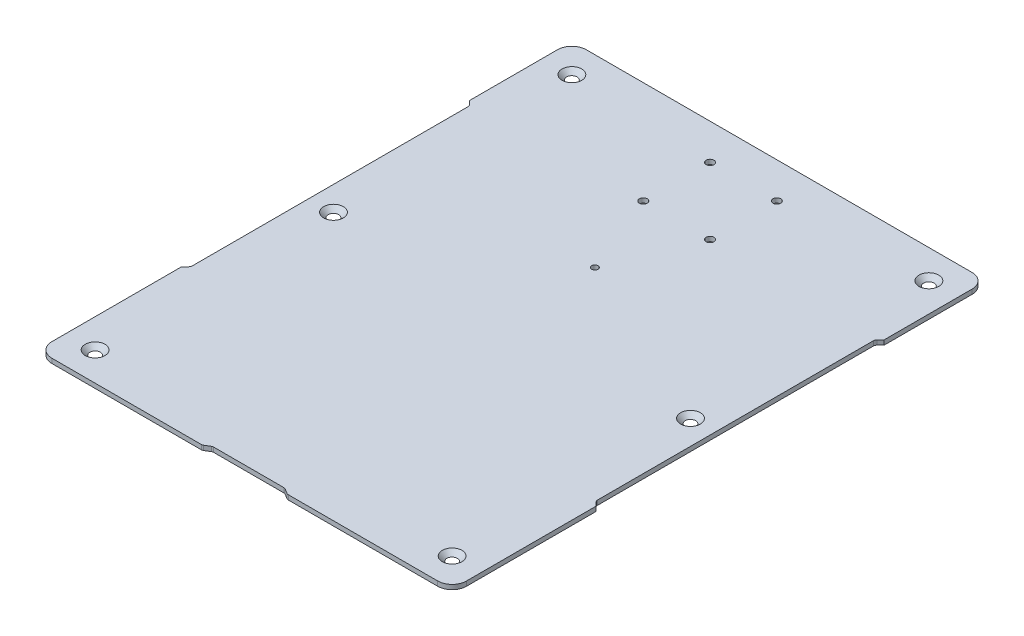
from build123d import *

# Parameters (mm, degrees)
SKETCH1_W           = 360
SKETCH1_H           = 464
SKETCH1_R           = 3.4
SKETCH1_R_2         = 2.731026391
BOSS_EXTRUDE1_DEPTH = 4
FILLET1_R           = 12.5
SKETCH5_R           = 3.4
CUT_EXTRUDE4_DEPTH  = 20
CUT_EXTRUDE5_DEPTH  = 10
CUT_EXTRUDE6_DEPTH  = 10
FILLET2_R           = 3
CHAMFER1_SIZE       = 5.15


with BuildPart() as part:
    # Sketch1 → Boss-Extrude1 (new body)
    with BuildSketch(Plane(origin=(0, 30, 0), x_dir=(1, 0, 0), z_dir=(0, 1, 0))):
        Rectangle(SKETCH1_W, SKETCH1_H)
        with Locations(Location((-155, 207, 0), (0, 0, 270))):
            Circle(SKETCH1_R, mode=Mode.SUBTRACT)
        with Locations(Location((155, 207, 0), (0, 0, 90))):
            Circle(SKETCH1_R, mode=Mode.SUBTRACT)
        with Locations(Location((-155, -207, 0), (0, 0, 270))):
            Circle(SKETCH1_R, mode=Mode.SUBTRACT)
        with Locations(Location((155, -207, 0), (0, 0, 90))):
            Circle(SKETCH1_R, mode=Mode.SUBTRACT)
        with Locations(Location((-155, 0, 0), (0, 0, 270))):
            Circle(SKETCH1_R, mode=Mode.SUBTRACT)
        with Locations(Location((155, 0, 0), (0, 0, 90))):
            Circle(SKETCH1_R, mode=Mode.SUBTRACT)
        with Locations(Location((0, 72, 0), (0, 0, 270))):
            Circle(SKETCH1_R_2, mode=Mode.SUBTRACT)
    extrude(amount=-BOSS_EXTRUDE1_DEPTH)

    # Fillet1
    fillet1_edges = [part.edges().sort_by_distance(p)[0] for p in [
        (180, 28, -232),
        (180, 28, 232),
        (-180, 28, 232),
        (-180, 28, -232),
    ]]
    fillet(fillet1_edges, radius=FILLET1_R)

    # Sketch5 → Cut-Extrude4 (cut)
    with BuildSketch(Plane(origin=(0, 40, 377.333920735), x_dir=(0, 0, 1), z_dir=(0, 1, 0))):
        with Locations((-520.342542706, 28.991378029)):
            Circle(SKETCH5_R)
        with Locations((-520.342542706, -28.991378029)):
            Circle(SKETCH5_R)
        with Locations((-578.325298763, -28.991378029)):
            Circle(SKETCH5_R)
        with Locations((-578.325298763, 28.991378029)):
            Circle(SKETCH5_R)
    extrude(amount=-CUT_EXTRUDE4_DEPTH, mode=Mode.SUBTRACT)

    # Sketch6 → Cut-Extrude5 (cut)
    with BuildSketch(Plane(origin=(0, 30, 0), x_dir=(1, 0, 0), z_dir=(0, 1, 0))):
        Polygon((-176, -102.929588377), (-176, 139.070411623), (-188.727922061, 151.798333685), (-188.727922061, -115.657510438), align=None)
    cut_extrude5 = extrude(amount=-CUT_EXTRUDE5_DEPTH, mode=Mode.SUBTRACT)

    # Sketch7 → Cut-Extrude6 (cut)
    with BuildSketch(Plane(origin=(0, 30, 0), x_dir=(1, 0, 0), z_dir=(0, 1, 0))):
        Polygon((-31.320564901, -228.594250629), (31.320564901, -228.594250629), (45, -236.893229805), (-45, -236.893229805), align=None)
    extrude(amount=-CUT_EXTRUDE6_DEPTH, mode=Mode.SUBTRACT)

    # Mirror2: Cut-Extrude5 across plane
    add(cut_extrude5.mirror(Plane(origin=(0, 0, 0), x_dir=(0, 0, 1), z_dir=(1, 0, 0))), mode=Mode.SUBTRACT)

    # Fillet2
    fillet2_edges = [part.edges().sort_by_distance(p)[0] for p in [
        (36.934355042, 28, 232),
        (-36.934355042, 28, 232),
        (-31.320564901, 28, 228.594250629),
        (31.320564901, 28, 228.594250629),
        (176, 28, 102.929588377),
        (176, 28, -139.070411623),
        (-176, 28, -139.070411623),
        (-176, 28, 102.929588377),
    ]]
    fillet(fillet2_edges, radius=FILLET2_R)

    # Chamfer1
    # the kernel refuses this chamfer: 5.15 mm, written as the material it takes off along each edge
    with BuildSketch(Plane(origin=(-155, 30, -207), x_dir=(0, 0, 1), z_dir=(-1, 0, 0))) as chamfer1_piece_1:
        Polygon((3.4 + CHAMFER1_SIZE, 0), (3.4, -CHAMFER1_SIZE), (3.4, 0), align=None)
    revolve(axis=Axis((-155, 30, -207), (0, 1, 0)), mode=Mode.SUBTRACT)
    with BuildSketch(Plane(origin=(155, 30, 207), x_dir=(0, 0, -1), z_dir=(1, 0, 0))) as chamfer1_piece_2:
        Polygon((3.4 + CHAMFER1_SIZE, 0), (3.4, -CHAMFER1_SIZE), (3.4, 0), align=None)
    revolve(axis=Axis((155, 30, 207), (0, 1, 0)), mode=Mode.SUBTRACT)
    with BuildSketch(Plane(origin=(155, 30, 0), x_dir=(0, 0, -1), z_dir=(1, 0, 0))) as chamfer1_piece_3:
        Polygon((3.4 + CHAMFER1_SIZE, 0), (3.4, -CHAMFER1_SIZE), (3.4, 0), align=None)
    revolve(axis=Axis((155, 30, 0), (0, 1, 0)), mode=Mode.SUBTRACT)
    with BuildSketch(Plane(origin=(-155, 30, 207), x_dir=(0, 0, 1), z_dir=(-1, 0, 0))) as chamfer1_piece_4:
        Polygon((3.4 + CHAMFER1_SIZE, 0), (3.4, -CHAMFER1_SIZE), (3.4, 0), align=None)
    revolve(axis=Axis((-155, 30, 207), (0, 1, 0)), mode=Mode.SUBTRACT)
    with BuildSketch(Plane(origin=(-155, 30, 0), x_dir=(0, 0, 1), z_dir=(-1, 0, 0))) as chamfer1_piece_5:
        Polygon((3.4 + CHAMFER1_SIZE, 0), (3.4, -CHAMFER1_SIZE), (3.4, 0), align=None)
    revolve(axis=Axis((-155, 30, 0), (0, 1, 0)), mode=Mode.SUBTRACT)
    with BuildSketch(Plane(origin=(155, 30, -207), x_dir=(0, 0, -1), z_dir=(1, 0, 0))) as chamfer1_piece_6:
        Polygon((3.4 + CHAMFER1_SIZE, 0), (3.4, -CHAMFER1_SIZE), (3.4, 0), align=None)
    revolve(axis=Axis((155, 30, -207), (0, 1, 0)), mode=Mode.SUBTRACT)


solid = part.part
